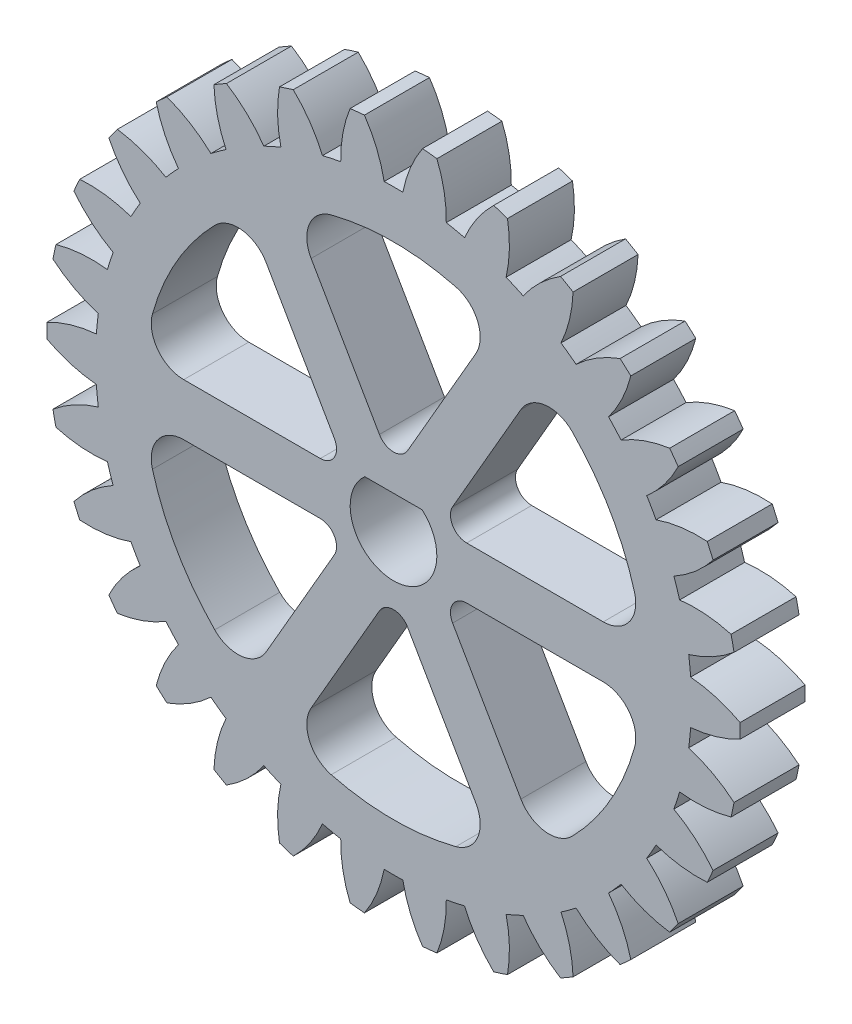
from build123d import *

# Parameters (mm, degrees)
SKETCH1_R           = 16
BOSS_EXTRUDE1_DEPTH = 3
CUT_EXTRUDE1_DEPTH  = 23.825424421
CIRPATTERN1_COUNT   = 30
CUT_EXTRUDE3_DEPTH  = 23.786066516
CIRPATTERN2_COUNT   = 6
CUT_EXTRUDE4_DEPTH  = 23.786066516


with BuildPart() as part:
    # Sketch1 → Boss-Extrude1 (new body)
    with BuildSketch(Plane.XY):
        Circle(SKETCH1_R)
    extrude(amount=BOSS_EXTRUDE1_DEPTH)

    # Sketch2 → Cut-Extrude1 (cut, through all)
    with BuildSketch(Plane.XY.offset(3)):
        with BuildLine():
            ThreePointArc((-1.339840569, 15.943802158), (-0.775178306, 14.889054262), (-0.43100755, 13.743243158))
            ThreePointArc((-0.43100755, 13.743243158), (0, 13.75), (0.43100755, 13.743243158))
            ThreePointArc((0.43100755, 13.743243158), (0.775178306, 14.889054262), (1.339840569, 15.943802158))
            ThreePointArc((1.339840569, 15.943802158), (0, 16), (-1.339840569, 15.943802158))
        make_face()
    cut_extrude1 = extrude(amount=-CUT_EXTRUDE1_DEPTH, mode=Mode.SUBTRACT)

    # CirPattern1: Cut-Extrude1 ×30 about axis
    cirpattern1_axis = Axis((0, 0, 3), (0, 0, 1))
    for i in range(1, CIRPATTERN1_COUNT):
        add(cut_extrude1.rotate(cirpattern1_axis, i * 360 / CIRPATTERN1_COUNT), mode=Mode.SUBTRACT)

    # Sketch3 → Cut-Extrude3 (cut, through all)
    with BuildSketch(Plane.XY.offset(3)):
        with BuildLine():
            Line((-3.377499075, 1.2), (-9.68052168, 1.2))
            ThreePointArc((-9.68052168, 1.2), (-10.875192683, 1.792938153), (-11.125375662, 3.102985075))
            ThreePointArc((-11.125375662, 3.102985075), (-10.002593414, 5.775), (-8.249951733, 8.083365413))
            ThreePointArc((-8.249951733, 8.083365413), (-6.99032633, 8.521724058), (-5.879491325, 7.783577697))
            Line((-5.879491325, 7.783577697), (-2.727980022, 2.325))
            ThreePointArc((-2.727980022, 2.325), (-2.727980022, 1.575), (-3.377499075, 1.2))
        make_face()
    cut_extrude3 = extrude(amount=-CUT_EXTRUDE3_DEPTH, mode=Mode.SUBTRACT)

    # CirPattern2: Cut-Extrude3 ×6 about axis
    cirpattern2_axis = Axis((0, 0, 3), (0, 0, -1))
    for i in range(1, CIRPATTERN2_COUNT):
        add(cut_extrude3.rotate(cirpattern2_axis, i * 360 / CIRPATTERN2_COUNT), mode=Mode.SUBTRACT)

    # Sketch4 → Cut-Extrude4 (cut, through all)
    with BuildSketch(Plane.XY.offset(3)):
        with BuildLine():
            Line((-1.322875656, 1.5), (1.322875656, 1.5))
            ThreePointArc((1.322875656, 1.5), (0, -2), (-1.322875656, 1.5))
        make_face()
    extrude(amount=-CUT_EXTRUDE4_DEPTH, mode=Mode.SUBTRACT)


solid = part.part
